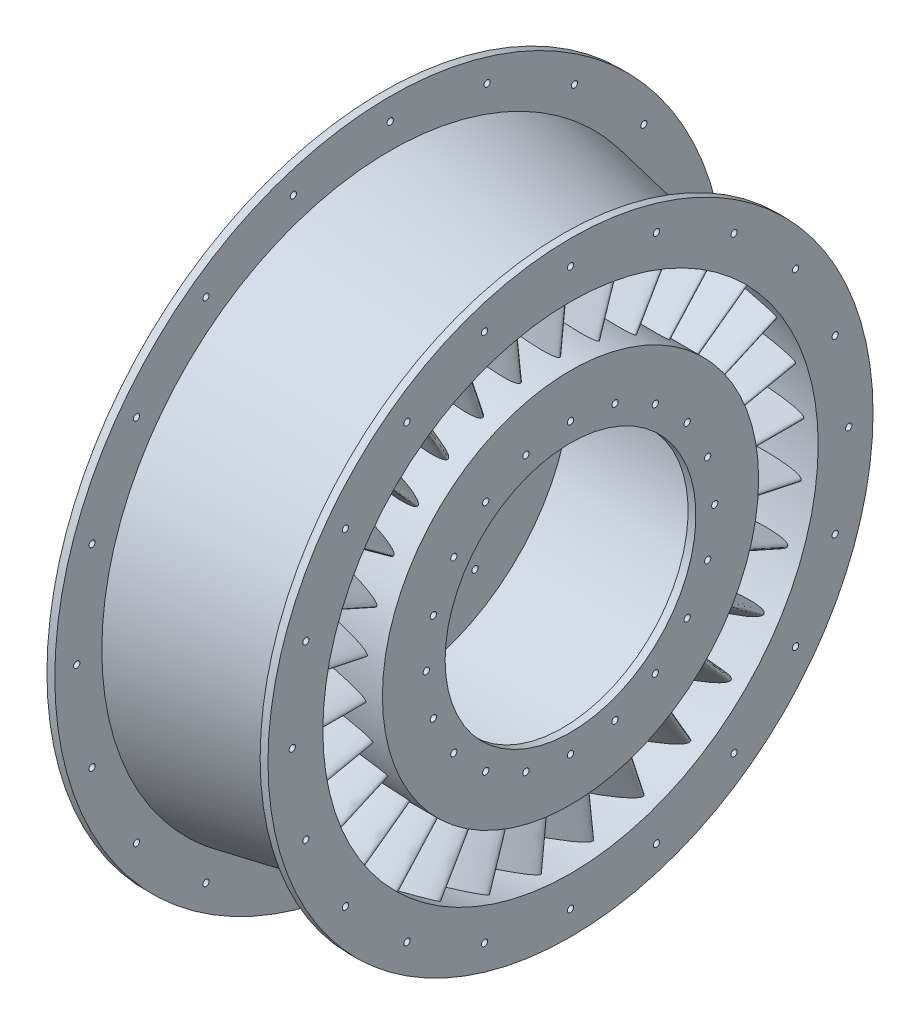
from build123d import *

# Parameters (mm, degrees)
BOSS_EXTRUDE1_REACH = 425.532
BOSS_EXTRUDE1_START = 115
SKETCH2_RX          = 50
SKETCH2_RY          = 6
CIRPATTERN1_COUNT   = 30
SKETCH3_R           = 2
CUT_EXTRUDE1_DEPTH  = 326.564125825
SKETCH4_R           = 2
CUT_EXTRUDE2_DEPTH  = 5
SKETCH5_R           = 2
BOSS_EXTRUDE2_DEPTH = 5
CIRPATTERN2_COUNT   = 10


with BuildPart() as part:
    # Sketch1 → Revolve1 (revolve)
    with BuildSketch(Plane.XY, mode=Mode.PRIVATE) as revolve1_sk:
        Polygon((60, 120), (60, 80), (55, 80), (55, 115), (-55, 115), (-55, 80), (-60, 80), (-60, 120), align=None)
        Polygon((60, 193), (55, 193), (55, 163), (-55, 184), (-55, 214), (-60, 214), (-60, 179), (60, 158), align=None)
    revolve(revolve1_sk.sketch.rotate(Axis((-71.7543299, 0, 0), (1, 0, 0)), 90), axis=Axis((-71.7543299, 0, 0), (1, 0, 0)))

    # Boss-Extrude1: up to this cone (the profile starts inside it)
    boss_extrude1_end = Plane(origin=(0, 0, 0), z_dir=(-1, 0, 0)) * Cone(64.4569, 272.5431, 1189.064, mode=Mode.PRIVATE)
    # Sketch2 → Boss-Extrude1 (add, up to the surface)
    with BuildSketch(Plane.XY.offset(BOSS_EXTRUDE1_START), mode=Mode.PRIVATE) as boss_extrude1_sk1:
        with Locations(Location((0, 0), (0, 0, 170))):
            Ellipse(SKETCH2_RX, SKETCH2_RY)
    boss_extrude1_tool1 = extrude(boss_extrude1_sk1.sketch, amount=BOSS_EXTRUDE1_REACH, mode=Mode.PRIVATE) & boss_extrude1_end
    boss_extrude1 = boss_extrude1_tool1.solids().sort_by_distance((0, 0, 115))[0]
    add(boss_extrude1)

    # CirPattern1: Boss-Extrude1 ×30 about axis
    cirpattern1_axis = Axis((-60, 0, 0), (-1, 0, 0))
    for i in range(1, CIRPATTERN1_COUNT):
        add(boss_extrude1.rotate(cirpattern1_axis, i * 360 / CIRPATTERN1_COUNT))

    # Sketch3 → Cut-Extrude1 (cut, through all)
    with BuildSketch(Plane.ZY.offset(60)):
        with Locations((0, 200)):
            Circle(SKETCH3_R)
        with Locations((0, 92)):
            Circle(SKETCH3_R)
        with Locations((61.803398875, 190.211303259)):
            Circle(SKETCH3_R)
        with Locations((28.429563482, 87.497199499)):
            Circle(SKETCH3_R)
        with Locations((117.557050458, 161.803398875)):
            Circle(SKETCH3_R)
        with Locations((54.076243211, 74.429563483)):
            Circle(SKETCH3_R)
        with Locations((161.803398875, 117.557050459)):
            Circle(SKETCH3_R)
        with Locations((74.429563482, 54.076243211)):
            Circle(SKETCH3_R)
        with Locations((190.211303259, 61.803398875)):
            Circle(SKETCH3_R)
        with Locations((87.497199499, 28.429563483)):
            Circle(SKETCH3_R)
        with Locations((200, 0)):
            Circle(SKETCH3_R)
        with Locations((92, 0)):
            Circle(SKETCH3_R)
        with Locations((190.211303259, -61.803398875)):
            Circle(SKETCH3_R)
        with Locations((87.497199499, -28.429563482)):
            Circle(SKETCH3_R)
        with Locations((161.803398875, -117.557050458)):
            Circle(SKETCH3_R)
        with Locations((74.429563483, -54.076243211)):
            Circle(SKETCH3_R)
        with Locations((117.557050459, -161.803398875)):
            Circle(SKETCH3_R)
        with Locations((54.076243211, -74.429563482)):
            Circle(SKETCH3_R)
        with Locations((61.803398875, -190.211303259)):
            Circle(SKETCH3_R)
        with Locations((28.429563483, -87.497199499)):
            Circle(SKETCH3_R)
        with Locations((0, -200)):
            Circle(SKETCH3_R)
        with Locations((0, -92)):
            Circle(SKETCH3_R)
        with Locations((-61.803398875, -190.211303259)):
            Circle(SKETCH3_R)
        with Locations((-28.429563482, -87.497199499)):
            Circle(SKETCH3_R)
        with Locations((-117.557050458, -161.803398875)):
            Circle(SKETCH3_R)
        with Locations((-54.076243211, -74.429563483)):
            Circle(SKETCH3_R)
        with Locations((-161.803398875, -117.557050459)):
            Circle(SKETCH3_R)
        with Locations((-74.429563482, -54.076243211)):
            Circle(SKETCH3_R)
        with Locations((-190.211303259, -61.803398875)):
            Circle(SKETCH3_R)
        with Locations((-87.497199499, -28.429563483)):
            Circle(SKETCH3_R)
        with Locations((-200, 0)):
            Circle(SKETCH3_R)
        with Locations((-92, 0)):
            Circle(SKETCH3_R)
        with Locations((-190.211303259, 61.803398875)):
            Circle(SKETCH3_R)
        with Locations((-87.497199499, 28.429563482)):
            Circle(SKETCH3_R)
        with Locations((-161.803398875, 117.557050458)):
            Circle(SKETCH3_R)
        with Locations((-74.429563482, 54.076243211)):
            Circle(SKETCH3_R)
        with Locations((-117.557050458, 161.803398875)):
            Circle(SKETCH3_R)
        with Locations((-54.076243211, 74.429563482)):
            Circle(SKETCH3_R)
        with Locations((-61.803398875, 190.211303259)):
            Circle(SKETCH3_R)
        with Locations((-28.429563482, 87.497199499)):
            Circle(SKETCH3_R)
    extrude(amount=-CUT_EXTRUDE1_DEPTH, mode=Mode.SUBTRACT)

    # Sketch4 → Cut-Extrude2 (cut)
    with BuildSketch(Plane(origin=(60, 0, 0), x_dir=(0, 0, -1), z_dir=(1, 0, 0))):
        with Locations((0, 177.5)):
            Circle(SKETCH4_R)
        with Locations((54.850516502, 168.812531642)):
            Circle(SKETCH4_R)
        with Locations((104.331882282, 143.600516502)):
            Circle(SKETCH4_R)
        with Locations((143.600516502, 104.331882282)):
            Circle(SKETCH4_R)
        with Locations((168.812531642, 54.850516502)):
            Circle(SKETCH4_R)
        with Locations((177.5, 0)):
            Circle(SKETCH4_R)
        with Locations((168.812531642, -54.850516502)):
            Circle(SKETCH4_R)
        with Locations((143.600516502, -104.331882282)):
            Circle(SKETCH4_R)
        with Locations((104.331882282, -143.600516502)):
            Circle(SKETCH4_R)
        with Locations((54.850516502, -168.812531642)):
            Circle(SKETCH4_R)
        with Locations((0, -177.5)):
            Circle(SKETCH4_R)
        with Locations((-54.850516502, -168.812531642)):
            Circle(SKETCH4_R)
        with Locations((-104.331882282, -143.600516502)):
            Circle(SKETCH4_R)
        with Locations((-143.600516502, -104.331882282)):
            Circle(SKETCH4_R)
        with Locations((-168.812531642, -54.850516502)):
            Circle(SKETCH4_R)
        with Locations((-177.5, 0)):
            Circle(SKETCH4_R)
        with Locations((-168.812531642, 54.850516502)):
            Circle(SKETCH4_R)
        with Locations((-143.600516502, 104.331882282)):
            Circle(SKETCH4_R)
        with Locations((-104.331882282, 143.600516502)):
            Circle(SKETCH4_R)
        with Locations((-54.850516502, 168.812531642)):
            Circle(SKETCH4_R)
    extrude(amount=-CUT_EXTRUDE2_DEPTH, mode=Mode.SUBTRACT)

    # Sketch5 → Boss-Extrude2 (add)
    with BuildSketch(Plane.ZY.offset(60)):
        with Locations((28.429563482, 87.497199499)):
            Circle(SKETCH5_R)
    boss_extrude2 = extrude(amount=-BOSS_EXTRUDE2_DEPTH)

    # CirPattern2: Boss-Extrude2 ×10 about axis
    cirpattern2_axis = Axis((-60, 0, 0), (-1, 0, 0))
    for i in range(1, CIRPATTERN2_COUNT):
        add(boss_extrude2.rotate(cirpattern2_axis, i * 360 / CIRPATTERN2_COUNT))


solid = part.part
